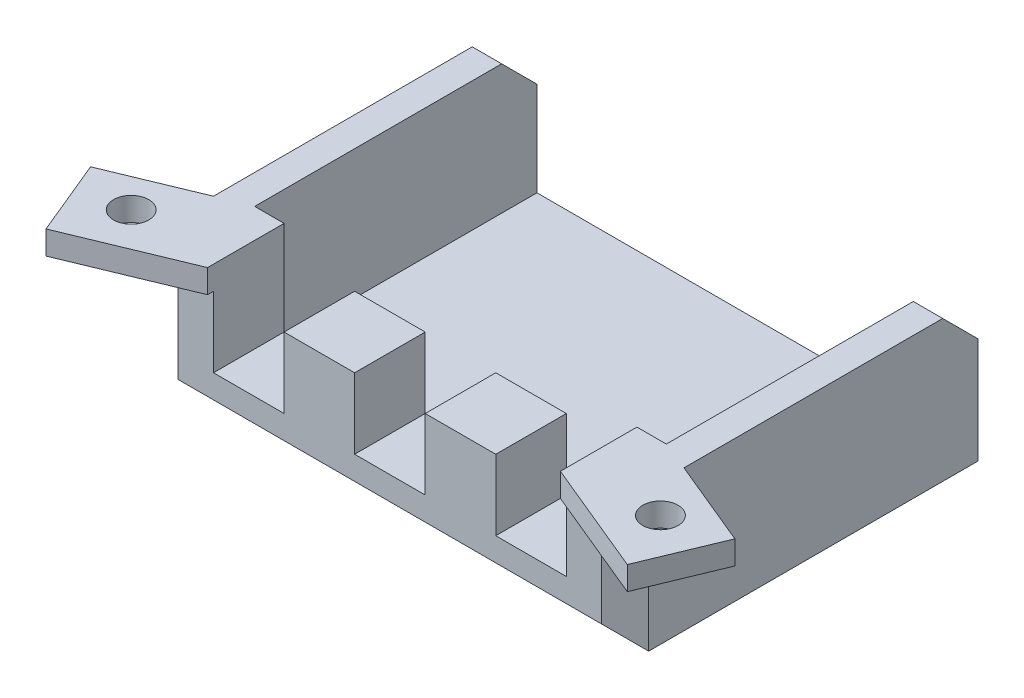
from build123d import *

# Parameters (mm, degrees)
SKETCH1_W           = 40
SKETCH1_H           = 30
BOSS_EXTRUDE1_DEPTH = 10
SKETCH5_W           = 40
SKETCH5_H           = 27
BOSS_EXTRUDE2_DEPTH = 3
SKETCH2_W           = 11
SKETCH2_H           = 24
CUT_EXTRUDE1_DEPTH  = 11
SKETCH4_W           = 6
SKETCH4_H           = 6
CUT_EXTRUDE2_DEPTH  = 8
SKETCH6_W           = 18
SKETCH6_H           = 16
CUT_EXTRUDE3_DEPTH  = 2
CHAMFER2_SIZE       = 3
BOSS_EXTRUDE3_DEPTH = 2
SKETCH9_R           = 1.5
CUT_EXTRUDE5_DEPTH  = 2
SKETCH11_W          = 40
SKETCH11_H          = 30
CUT_EXTRUDE6_DEPTH  = 1
CHAMFER3_SIZE       = 2
SKETCH14_W          = 6
SKETCH14_H          = 2
BOSS_EXTRUDE4_DEPTH = 4
SKETCH15_R          = 1.5
CUT_EXTRUDE7_DEPTH  = 4
CHAMFER7_SIZE       = 4
SKETCH16_W          = 13
SKETCH16_H          = 6.5
CUT_EXTRUDE8_DEPTH  = 3
SKETCH17_W          = 35
SKETCH17_H          = 24
CUT_EXTRUDE9_DEPTH  = 11


with BuildPart() as part:
    # Sketch1 → Boss-Extrude1 (new body)
    with BuildSketch(Plane(origin=(0, 0, 0), x_dir=(1, 0, 0), z_dir=(0, 1, 0))):
        Rectangle(SKETCH1_W, SKETCH1_H)
    extrude(amount=BOSS_EXTRUDE1_DEPTH)

    # Sketch5 → Boss-Extrude2 (add)
    with BuildSketch(Plane(origin=(0, 10, 0), x_dir=(1, 0, 0), z_dir=(0, 1, 0))):
        with Locations((0, -1.5)):
            Rectangle(SKETCH5_W, SKETCH5_H)
    extrude(amount=BOSS_EXTRUDE2_DEPTH)

    # Sketch2 → Cut-Extrude1 (cut)
    with BuildSketch(Plane(origin=(0, 13, 0), x_dir=(1, 0, 0), z_dir=(0, 1, 0))):
        with Locations((-12, 3)):
            Rectangle(SKETCH2_W, SKETCH2_H)
        with Locations((0, 3)):
            Rectangle(SKETCH2_W, SKETCH2_H)
        with Locations((12, 3)):
            Rectangle(SKETCH2_W, SKETCH2_H)
    extrude(amount=-CUT_EXTRUDE1_DEPTH, mode=Mode.SUBTRACT)

    # Sketch4 → Cut-Extrude2 (cut)
    with BuildSketch(Plane(origin=(0, 13, 0), x_dir=(1, 0, 0), z_dir=(0, 1, 0))):
        with Locations((-12, -12)):
            Rectangle(SKETCH4_W, SKETCH4_H)
        with Locations((0, -12)):
            Rectangle(SKETCH4_W, SKETCH4_H)
        with Locations((12, -12)):
            Rectangle(SKETCH4_W, SKETCH4_H)
    extrude(amount=-CUT_EXTRUDE2_DEPTH, mode=Mode.SUBTRACT)

    # Sketch6 → Cut-Extrude3 (cut)
    with BuildSketch(Plane(origin=(0, 13, 0), x_dir=(1, 0, 0), z_dir=(0, 1, 0))):
        with Locations((0, -7)):
            Rectangle(SKETCH6_W, SKETCH6_H)
    extrude(amount=-CUT_EXTRUDE3_DEPTH, mode=Mode.SUBTRACT)

    # Chamfer2
    chamfer2_edges = [part.edges().sort_by_distance(p)[0] for p in [
        (18.75, 10, -12),
        (6, 10, -12),
        (-6, 10, -12),
        (-18.75, 10, -12),
    ]]
    chamfer(chamfer2_edges, length=CHAMFER2_SIZE - 0.0001)  # a hair under: the kernel refuses the full size

    # Sketch8 → Boss-Extrude3 (add)
    with BuildSketch(Plane(origin=(0, 13, 0), x_dir=(1, 0, 0), z_dir=(0, 1, 0))):
        Polygon((20, -10), (27.39103626, -13.061467459), (24.712252234, -19.528624186), (15, -15.50567759), (15, -15), (17.5, -9), align=None)
    boss_extrude3 = extrude(amount=-BOSS_EXTRUDE3_DEPTH)

    # Mirror1: Boss-Extrude3 across plane
    add(boss_extrude3.mirror(Plane(origin=(0, 0, 0), x_dir=(0, 0, 1), z_dir=(1, 0, 0))))

    # Sketch9 → Cut-Extrude5 (cut)
    with BuildSketch(Plane.XZ.offset(-11)):
        with Locations(Location((-22.5, 14.5, 0), (0, 0, 270))):
            Circle(SKETCH9_R)
        with Locations(Location((22.5, 14.5, 0), (0, 0, 270))):
            Circle(SKETCH9_R)
    extrude(amount=-CUT_EXTRUDE5_DEPTH, mode=Mode.SUBTRACT)

    # Sketch11 → Cut-Extrude6 (cut)
    with BuildSketch(Plane.XZ):
        Rectangle(SKETCH11_W, SKETCH11_H)
    extrude(amount=-CUT_EXTRUDE6_DEPTH, mode=Mode.SUBTRACT)

    # Chamfer3
    chamfer3_edges = [part.edges().sort_by_distance(p)[0] for p in [
        (20, 6, 15),
        (-20, 6, 15),
        (0, 1, 15),
    ]]
    chamfer(chamfer3_edges, length=CHAMFER3_SIZE)

    # Sketch14 → Boss-Extrude4 (add)
    with BuildSketch(Plane.XZ.offset(-1)):
        with Locations((0, -14)):
            Rectangle(SKETCH14_W, SKETCH14_H)
    extrude(amount=BOSS_EXTRUDE4_DEPTH)

    # Sketch15 → Cut-Extrude7 (cut)
    with BuildSketch(Plane(origin=(0, 0, -15), x_dir=(-1, 0, 0), z_dir=(0, 0, -1))):
        with Locations((0, -0.5)):
            Circle(SKETCH15_R)
    extrude(amount=-CUT_EXTRUDE7_DEPTH, mode=Mode.SUBTRACT)

    # Chamfer7
    chamfer7_edges = [part.edges().sort_by_distance(p)[0] for p in [
        (3, 1, -14),
        (-3, 1, -14),
    ]]
    chamfer(chamfer7_edges, length=CHAMFER7_SIZE - 0.0001)  # a hair under: the kernel refuses the full size

    # Sketch16 → Cut-Extrude8 (cut)
    with BuildSketch(Plane(origin=(0, 13, 0), x_dir=(1, 0, 0), z_dir=(0, 1, 0))):
        with Locations((0, 11.75)):
            Rectangle(SKETCH16_W, SKETCH16_H)
    extrude(amount=-CUT_EXTRUDE8_DEPTH, mode=Mode.SUBTRACT)

    # Sketch17 → Cut-Extrude9 (cut)
    with BuildSketch(Plane(origin=(0, 13, 0), x_dir=(1, 0, 0), z_dir=(0, 1, 0))):
        with Locations((0, 3)):
            Rectangle(SKETCH17_W, SKETCH17_H)
    extrude(amount=-CUT_EXTRUDE9_DEPTH, mode=Mode.SUBTRACT)


solid = part.part
